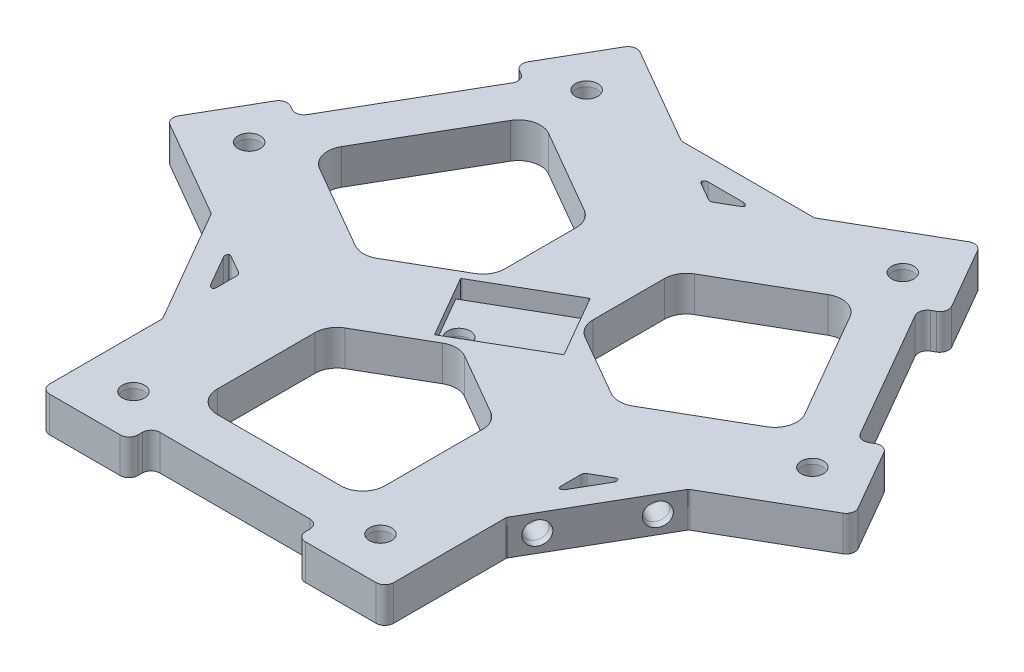
from build123d import *
from OCP.BRepFilletAPI import BRepFilletAPI_MakeChamfer

# Parameters (mm, degrees)
BOSS_EXTRUDE1_DEPTH         = 8
SKETCH3_R                   = 2.3750000000000027
SKETCH3_R_2                 = 2.3749999999999987
CUT_EXTRUDE1_DEPTH          = 7
FILLET1_R                   = 1
CIRPATTERN4_COUNT           = 3
FILLET1_OF_CIRPATTERN4_R    = 1
CHAMFER1_SIZE               = 0.15
CHAMFER1_SIZE2              = 1.0673054583576573
CUT_EXTRUDE2_REACH          = 105.494
SKETCH6_W                   = 37.999999999999986
SKETCH6_H                   = 5
FILLET2_R                   = 2
FILLET3_R                   = 5
BOSS_EXTRUDE2_DEPTH         = 8
SKETCH8_R                   = 2.3750000000000004
CUT_EXTRUDE3_DEPTH          = 7
FILLET4_R                   = 1
CIRPATTERN5_COUNT           = 3
FILLET4_OF_CIRPATTERN5_R    = 1
CHAMFER2_SIZE               = 0.2
CHAMFER2_SIZE2              = 1.4230739444768743
CHAMFER2_SIZE2_2            = 1.423073944476883
CHAMFER2_SIZE2_3            = 1.423073944476881
FILLET5_R                   = 1
FILLET6_R                   = 1
CUT_EXTRUDE4_DEPTH          = 2
SKETCH10_R                  = 2.3749999999999982
CUT_EXTRUDE5_DEPTH          = 6.5
CHAMFER3_SIZE               = 0.2
CHAMFER3_SIZE2              = 1.4230739444768743
FILLET8_R                   = 0.2
SKETCH17_W                  = 15.99999999999999
SKETCH17_H                  = 8
SKETCH17_W_2                = 15.999999999999972
BOSS_EXTRUDE3_DEPTH         = 20
CIRPATTERN7_COUNT           = 3
CUT_EXTRUDE12_REACH         = 104.943
SKETCH18_R                  = 2.375000000000023
SKETCH18_R_2                = 2.3750000000000027
SKETCH18_R_3                = 2.375000000005001
SKETCH18_R_4                = 2.375000000005148
SKETCH18_R_5                = 2.374999999999309
SKETCH18_R_6                = 2.374999999999633
CHAMFER4_SIZE               = 0.15
CHAMFER4_SIZE2              = 1.0673054583576556
LPATTERN1_COUNT             = 2
LPATTERN1_PITCH             = 33
CHAMFER3_OF_LPATTERN1_SIZE2 = 1.4230739444768743
CHAMFER3_OF_LPATTERN1_SIZE  = 0.2
FILLET8_OF_LPATTERN1_R      = 0.2
BOSS_EXTRUDE4_DEPTH         = 8


with BuildPart() as part:
    # Sketch1 → Boss-Extrude1 (new body)
    with BuildSketch(Plane(origin=(0, 0, 0), x_dir=(1, 0, 0), z_dir=(0, 1, 0))):
        Polygon((-39, 67.54998149518622), (-78.00000000000001, 1.423e-14), (-38.999999999999964, -67.54998149518627), (39.000000000000036, -67.54998149518624), (78.00000000000004, 7.21e-15), (39.00000000000003, 67.54998149518623), align=None)
    extrude(amount=BOSS_EXTRUDE1_DEPTH)

    # Sketch3 → Cut-Extrude1 (cut)
    with BuildSketch(Plane.XY.offset(67.54998149518626)):
        with Locations((34, 3.9999999999999982)):
            Circle(SKETCH3_R)
        with Locations((-34, 4)):
            Circle(SKETCH3_R)
        with Locations((-24, 4.000000000000001)):
            Circle(SKETCH3_R_2)
        with Locations((24, 3.9999999999999982)):
            Circle(SKETCH3_R_2)
    cut_extrude1 = extrude(amount=-CUT_EXTRUDE1_DEPTH, mode=Mode.SUBTRACT)

    # Fillet1
    fillet1_edges = [part.edges().sort_by_distance(p)[0] for p in [
        (31.62500000000002, 3.9999999999999987, 60.54998149518626),
        (-36.37499999999998, 4, 60.54998149518626),
        (-26.374999999999975, 4.000000000000001, 60.54998149518626),
        (21.625000000000025, 3.9999999999999987, 60.54998149518626),
    ]]
    fillet(fillet1_edges, radius=FILLET1_R)

    # CirPattern4: Cut-Extrude1 ×3 about axis
    cirpattern4_axis = Axis((1.202e-14, 0, -5.78e-15), (0, 1, 0))
    for i in range(1, CIRPATTERN4_COUNT):
        add(cut_extrude1.rotate(cirpattern4_axis, i * 360 / CIRPATTERN4_COUNT), mode=Mode.SUBTRACT)

    # Fillet1 of CirPattern4
    fillet1_of_cirpattern4_edges = [part.edges().sort_by_distance(p)[0] for p in [
        (36.625322173508984, 3.9999999999999987, -57.66304414227601),
        (70.62532217350898, 4, 1.2266833150658254),
        (65.62532217350898, 4.000000000000001, -7.433570722778564),
        (41.625322173508984, 3.9999999999999987, -49.002790104431625),
        (-68.25032217350896, 3.9999999999999987, -2.8869373529102957),
        (-34.25032217350893, 4, -61.77666481025211),
        (-39.250322173508934, 4.000000000000001, -53.11641077240772),
        (-63.250322173508955, 3.9999999999999987, -11.547191390754675),
    ]]
    fillet(fillet1_of_cirpattern4_edges, radius=FILLET1_OF_CIRPATTERN4_R)

    # Chamfer1: one chamfer whose edges measure the first distance from different faces: ONE call of the kernel's chamfer builder (chamfer() names one face for all edges)
    chamfer1_edges_1 = [part.edges().sort_by_distance(p)[0] for p in [
        (31.62500000000002, 3.9999999999999987, 67.54998149518626),
        (-36.37499999999998, 4, 67.54998149518626),
        (-26.374999999999975, 4.000000000000001, 67.54998149518626),
        (21.625000000000025, 3.9999999999999987, 67.54998149518626),
    ]]
    chamfer1_side_1 = [part.faces().sort_by_distance(p)[0] for p in [
        (4.174e-14, 4.000000000000001, 67.54998149518626),
    ]]
    chamfer1_edges_2 = [part.edges().sort_by_distance(p)[0] for p in [
        (76.68750000000004, 4, -2.27331668493418),
        (71.68750000000004, 4.000000000000001, -10.933570722778565),
        (47.68750000000006, 3.9999999999999987, -52.502790104431625),
        (42.68750000000006, 3.9999999999999987, -61.16304414227601),
    ]]
    chamfer1_side_2 = [part.faces().sort_by_distance(p)[0] for p in [
        (58.50000000000003, 4.000000000000001, -33.77499074759312),
    ]]
    chamfer1_edges_3 = [part.edges().sort_by_distance(p)[0] for p in [
        (-74.31250000000003, 3.9999999999999987, -6.386937352910298),
        (-40.3125, 4, -65.2766648102521),
        (-45.31250000000001, 4.000000000000001, -56.61641077240772),
        (-69.31250000000003, 3.9999999999999987, -15.047191390754676),
    ]]
    chamfer1_side_3 = [part.faces().sort_by_distance(p)[0] for p in [
        (-58.50000000000001, 4.000000000000001, -33.774990747593115),
    ]]
    chamfer1 = BRepFilletAPI_MakeChamfer(part.part.solid().wrapped)
    for e in chamfer1_edges_1:
        chamfer1.Add(CHAMFER1_SIZE, CHAMFER1_SIZE2, e.wrapped, chamfer1_side_1[0].wrapped)  # the first distance lies on this face
    for e in chamfer1_edges_2:
        chamfer1.Add(CHAMFER1_SIZE, CHAMFER1_SIZE2, e.wrapped, chamfer1_side_2[0].wrapped)  # the first distance lies on this face
    for e in chamfer1_edges_3:
        chamfer1.Add(CHAMFER1_SIZE, CHAMFER1_SIZE2, e.wrapped, chamfer1_side_3[0].wrapped)  # the first distance lies on this face
    add(Compound.cast(chamfer1.Shape()), mode=Mode.REPLACE)

    # Sketch6 → Cut-Extrude2 (cut, up to next)
    with BuildSketch(Plane(origin=(0, 8, 0), x_dir=(1, 0, 0), z_dir=(0, 1, 0)), mode=Mode.PRIVATE) as cut_extrude2_sk1:
        Polygon((39.00000000000069, 67.54998149518588), (-9.7e-16, 45.03332099679091), (-38.999999999999766, 67.5499814951864), align=None)
    cut_extrude2_tool1 = extrude(cut_extrude2_sk1.sketch, amount=-CUT_EXTRUDE2_REACH, mode=Mode.PRIVATE) & part.part
    # Sketch6 → Cut-Extrude2 (cut, up to next)
    with BuildSketch(Plane(origin=(0, 8, 0), x_dir=(1, 0, 0), z_dir=(0, 1, 0)), mode=Mode.PRIVATE) as cut_extrude2_sk2:
        Polygon((-36.009618943233434, 42.72947341949735), (-9.999999999999911, 27.7128129211021), (-9.999999999999973, 5.773502691896304), (-29.000000000000057, -5.196152422706482), (-55.00961894323343, 9.82050807568869), (-45.50961894323342, 26.274990747593012), align=None)
    cut_extrude2_tool2 = extrude(cut_extrude2_sk2.sketch, amount=-CUT_EXTRUDE2_REACH, mode=Mode.PRIVATE) & part.part
    # Sketch6 → Cut-Extrude2 (cut, up to next)
    with BuildSketch(Plane(origin=(0, 8, 0), x_dir=(1, 0, 0), z_dir=(0, 1, 0)), mode=Mode.PRIVATE) as cut_extrude2_sk3:
        Polygon((-78.00000000000006, 4.0939e-13), (-38.999999999999964, -22.51666049839541), (-38.999999999999964, -67.54998149518627), align=None)
    cut_extrude2_tool3 = extrude(cut_extrude2_sk3.sketch, amount=-CUT_EXTRUDE2_REACH, mode=Mode.PRIVATE) & part.part
    # Sketch6 → Cut-Extrude2 (cut, up to next)
    with BuildSketch(Plane(origin=(0, 8, 0), x_dir=(1, 0, 0), z_dir=(0, 1, 0)), mode=Mode.PRIVATE) as cut_extrude2_sk4:
        Polygon((-18.999999999999993, -52.549981495186294), (-2.3e-16, -52.54998149518628), (18.999999999999993, -52.549981495186294), (19, -22.51666049839544), (0, -11.547005383792502), (-18.999999999999993, -22.516660498395435), align=None)
    cut_extrude2_tool4 = extrude(cut_extrude2_sk4.sketch, amount=-CUT_EXTRUDE2_REACH, mode=Mode.PRIVATE) & part.part
    # Sketch6 → Cut-Extrude2 (cut, up to next)
    with BuildSketch(Plane(origin=(0, 8, 0), x_dir=(1, 0, 0), z_dir=(0, 1, 0)), mode=Mode.PRIVATE) as cut_extrude2_sk5:
        Polygon((55.00961894323342, 9.820508075688727), (28.999999999999982, -5.196152422706877), (10.000000000000048, 5.773502691896163), (10.00000000000028, 27.712812921101953), (36.009618943233406, 42.72947341949738), (45.50961894323341, 26.274990747593044), align=None)
    cut_extrude2_tool5 = extrude(cut_extrude2_sk5.sketch, amount=-CUT_EXTRUDE2_REACH, mode=Mode.PRIVATE) & part.part
    # Sketch6 → Cut-Extrude2 (cut, up to next)
    with BuildSketch(Plane(origin=(0, 8, 0), x_dir=(1, 0, 0), z_dir=(0, 1, 0)), mode=Mode.PRIVATE) as cut_extrude2_sk6:
        Polygon((78.00000000000004, -6.6093e-13), (38.99999999999998, -22.516660498395257), (38.99999999999998, -67.54998149518627), align=None)
    cut_extrude2_tool6 = extrude(cut_extrude2_sk6.sketch, amount=-CUT_EXTRUDE2_REACH, mode=Mode.PRIVATE) & part.part
    # Sketch6 → Cut-Extrude2 (cut, up to next)
    with BuildSketch(Plane(origin=(0, 8, 0), x_dir=(1, 0, 0), z_dir=(0, 1, 0)), mode=Mode.PRIVATE) as cut_extrude2_sk7:
        Polygon((-49.00000000000007, 50.22947341949745), (-44.66987298107787, 47.72947341949745), (-63.66987298107786, 14.820508075688792), (-68.00000000000006, 17.320508075688792), align=None)
    cut_extrude2_tool7 = extrude(cut_extrude2_sk7.sketch, amount=-CUT_EXTRUDE2_REACH, mode=Mode.PRIVATE) & part.part
    # Sketch6 → Cut-Extrude2 (cut, up to next)
    with BuildSketch(Plane(origin=(0, 8, 0), x_dir=(1, 0, 0), z_dir=(0, 1, 0)), mode=Mode.PRIVATE) as cut_extrude2_sk8:
        Polygon((68.00000000000004, 17.320508075688842), (63.669872981077845, 14.82050807568884), (44.669872981077845, 47.72947341949749), (49.00000000000004, 50.22947341949749), align=None)
    cut_extrude2_tool8 = extrude(cut_extrude2_sk8.sketch, amount=-CUT_EXTRUDE2_REACH, mode=Mode.PRIVATE) & part.part
    # Sketch6 → Cut-Extrude2 (cut, up to next)
    with BuildSketch(Plane(origin=(0, 8, 0), x_dir=(1, 0, 0), z_dir=(0, 1, 0)), mode=Mode.PRIVATE) as cut_extrude2_sk9:
        with Locations((0, -65.04998149518627)):
            Rectangle(SKETCH6_W, SKETCH6_H)
    cut_extrude2_tool9 = extrude(cut_extrude2_sk9.sketch, amount=-CUT_EXTRUDE2_REACH, mode=Mode.PRIVATE) & part.part
    add(cut_extrude2_tool1.solids().sort_by_distance((0, 8, -60.044428))[0], mode=Mode.SUBTRACT)
    add(cut_extrude2_tool2.solids().sort_by_distance((-30.007558, 8, -17.324872))[0], mode=Mode.SUBTRACT)
    add(cut_extrude2_tool3.solids().sort_by_distance((-52, 8, 30.022214))[0], mode=Mode.SUBTRACT)
    add(cut_extrude2_tool4.solids().sort_by_distance((0, 8, 34.649743))[0], mode=Mode.SUBTRACT)
    add(cut_extrude2_tool5.solids().sort_by_distance((30.007558, 8, -17.324872))[0], mode=Mode.SUBTRACT)
    add(cut_extrude2_tool6.solids().sort_by_distance((52, 8, 30.022214))[0], mode=Mode.SUBTRACT)
    add(cut_extrude2_tool7.solids().sort_by_distance((-56.334936, 8, -32.524991))[0], mode=Mode.SUBTRACT)
    add(cut_extrude2_tool8.solids().sort_by_distance((56.334936, 8, -32.524991))[0], mode=Mode.SUBTRACT)
    add(cut_extrude2_tool9.solids().sort_by_distance((0, 8, 65.049981))[0], mode=Mode.SUBTRACT)

    # Fillet2
    fillet2_edges = [part.edges().sort_by_distance(p)[0] for p in [
        (39.00000000000003, 4, -67.54998149518623),
        (78.00000000000004, 4, -7.21e-15),
        (39.000000000000036, 4, 67.54998149518624),
        (-38.999999999999964, 4, 67.54998149518627),
        (-78.00000000000001, 4, -1.423e-14),
        (-39, 4, -67.54998149518622),
        (-18.999999999999993, 4, 62.54998149518627),
        (18.999999999999993, 4, 62.54998149518627),
        (18.999999999999993, 4, 67.54998149518627),
        (-18.999999999999993, 4, 67.54998149518627),
        (49.00000000000004, 4, -50.22947341949749),
        (68.00000000000004, 4, -17.320508075688842),
        (63.669872981077845, 4, -14.82050807568884),
        (44.669872981077845, 4, -47.72947341949749),
        (-68.00000000000006, 4, -17.320508075688792),
        (-49.00000000000007, 4, -50.22947341949745),
        (-44.66987298107787, 4, -47.72947341949745),
        (-63.66987298107786, 4, -14.820508075688792),
    ]]
    fillet(fillet2_edges, radius=FILLET2_R)

    # Fillet3
    fillet3_edges = [part.edges().sort_by_distance(p)[0] for p in [
        (55.00961894323342, 4, -9.820508075688727),
        (28.999999999999982, 4, 5.196152422706877),
        (10.000000000000048, 4, -5.773502691896163),
        (10.00000000000028, 4, -27.712812921101953),
        (36.009618943233406, 4, -42.72947341949738),
        (18.999999999999993, 4, 52.549981495186294),
        (-18.999999999999993, 4, 52.549981495186294),
        (-18.999999999999993, 4, 22.516660498395435),
        (0, 4, 11.547005383792502),
        (19, 4, 22.51666049839544),
        (-36.009618943233434, 4, -42.72947341949735),
        (-9.999999999999911, 4, -27.7128129211021),
        (-9.999999999999973, 4, -5.773502691896304),
        (-29.000000000000057, 4, 5.196152422706482),
        (-55.00961894323343, 4, -9.82050807568869),
    ]]
    fillet(fillet3_edges, radius=FILLET3_R)

    # Sketch7 → Boss-Extrude2 (add)
    with BuildSketch(Plane(origin=(0, 8, 0), x_dir=(1, 0, 0), z_dir=(0, 1, 0))):
        Polygon((-15, 53.69357503463551), (-15, 53.74998149518645), (-5.000000000000001, 53.74998149518645), (5.000000000000001, 53.74998149518645), (15, 53.74998149518645), (15, 53.69357503463551), (4.999999999999996, 47.920072342739246), (5.000000000000002, 48.74998149518646), (-5.000000000000002, 48.74998149518646), (-4.999999999999996, 47.920072342739246), align=None)
        Polygon((39.04884942777496, -39.86537180435979), (44.048849427774954, -31.205117766515407), (49.04884942777496, -22.54486372867102), (54.048849427774954, -13.884609690826633), (54.00000000000022, -13.856406460551433), (44.00000000000018, -19.629909152447645), (44.71872240885278, -20.04486372867103), (39.71872240885278, -28.705117766515414), (39.00000000000014, -28.290163190292006), (39.0000000000001, -39.83716857408452), align=None)
        Polygon((-54.048849427774954, -13.884609690826673), (-49.04884942777495, -22.544863728671057), (-44.04884942777494, -31.205117766515443), (-39.04884942777494, -39.86537180435983), (-38.99999999999921, -39.83716857408482), (-38.99999999999921, -28.290163190292304), (-39.718722408852756, -28.705117766515443), (-44.71872240885276, -20.044863728671057), (-43.99999999999921, -19.629909152447922), (-53.999999999999226, -13.856406460551671), align=None)
    extrude(amount=-BOSS_EXTRUDE2_DEPTH)

    # Sketch8 → Cut-Extrude3 (cut)
    with BuildSketch(Plane(origin=(0, 0, -53.74998149518645), x_dir=(-1, 0, 0), z_dir=(0, 0, -1))):
        with Locations((-10.000000000000147, 4)):
            Circle(SKETCH8_R)
        with Locations((9.999999999999998, 3.999999999999999)):
            Circle(SKETCH8_R)
    cut_extrude3 = extrude(amount=-CUT_EXTRUDE3_DEPTH, mode=Mode.SUBTRACT)

    # Fillet4
    fillet4_edges = [part.edges().sort_by_distance(p)[0] for p in [
        (12.375000000000147, 4, -46.74998149518645),
        (-7.624999999999998, 3.9999999999999996, -46.74998149518645),
    ]]
    fillet(fillet4_edges, radius=FILLET4_R)

    # CirPattern5: Cut-Extrude3 ×3 about axis
    cirpattern5_axis = Axis((-1.402e-14, 0, 5.78e-15), (0, 1, 0))
    for i in range(1, CIRPATTERN5_COUNT):
        add(cut_extrude3.rotate(cirpattern5_axis, i * 360 / CIRPATTERN5_COUNT), mode=Mode.SUBTRACT)

    # Fillet4 of CirPattern5
    fillet4_of_cirpattern5_edges = [part.edges().sort_by_distance(p)[0] for p in [
        (-46.67417160128398, 4, 12.657926375760653),
        (-36.67417160128391, 3.9999999999999996, 29.97843445144955),
        (34.299171601283774, 4, 34.092055119425815),
        (44.29917160128385, 3.9999999999999996, 16.771547043736923),
    ]]
    fillet(fillet4_of_cirpattern5_edges, radius=FILLET4_OF_CIRPATTERN5_R)

    # Chamfer2: one chamfer whose edges measure the first distance from different faces: ONE call of the kernel's chamfer builder (chamfer() names one face for all edges)
    chamfer2_edges_1 = [part.edges().sort_by_distance(p)[0] for p in [
        (12.375000000000147, 4, -53.74998149518645),
        (-7.624999999999998, 3.9999999999999996, -53.74998149518645),
    ]]
    chamfer2_side_1 = [part.faces().sort_by_distance(p)[0] for p in [
        (-1.432e-14, 3.9999999999999996, -53.74998149518645),
    ]]
    chamfer2_edges_2 = [part.edges().sort_by_distance(p)[0] for p in [
        (-52.73634942777505, 4, 16.157926375760653),
        (-42.73634942777498, 3.9999999999999996, 33.47843445144955),
    ]]
    chamfer2_side_2 = [part.faces().sort_by_distance(p)[0] for p in [
        (-46.548849427774925, 3.9999999999999996, 26.874990747593273),
    ]]
    chamfer2_edges_3 = [part.edges().sort_by_distance(p)[0] for p in [
        (40.36134942777484, 4, 37.59205511942582),
        (50.36134942777492, 3.9999999999999996, 20.27154704373693),
    ]]
    chamfer2_side_3 = [part.faces().sort_by_distance(p)[0] for p in [
        (46.54884942777497, 4, 26.874990747593188),
    ]]
    chamfer2 = BRepFilletAPI_MakeChamfer(part.part.solid().wrapped)
    for e in chamfer2_edges_1:
        chamfer2.Add(CHAMFER2_SIZE, CHAMFER2_SIZE2, e.wrapped, chamfer2_side_1[0].wrapped)  # the first distance lies on this face
    for e in chamfer2_edges_2:
        chamfer2.Add(CHAMFER2_SIZE, CHAMFER2_SIZE2_2, e.wrapped, chamfer2_side_2[0].wrapped)  # the first distance lies on this face
    for e in chamfer2_edges_3:
        chamfer2.Add(CHAMFER2_SIZE, CHAMFER2_SIZE2_3, e.wrapped, chamfer2_side_3[0].wrapped)  # the first distance lies on this face
    add(Compound.cast(chamfer2.Shape()), mode=Mode.REPLACE)

    # Fillet5
    # the kernel refuses this fillet: 1 mm, written as the material it adds along each edge
    with BuildSketch(Plane(origin=(-39.718722408852756, 8, 28.705117766515443), x_dir=(0.8660254037849977, 0, -0.49999999999903166), z_dir=(0, -1, 0))) as fillet5_piece_1:
        with BuildLine():
            CenterArc((FILLET5_R, -FILLET5_R), FILLET5_R, 89.99999999999993, 89.9999999999357)
            Line((-1.11755e-12, -FILLET5_R), (0, 0))
            Line((0, 0), (FILLET5_R, 0))
        make_face()
    extrude(amount=8)
    with BuildSketch(Plane(origin=(-44.71872240885276, 8, 20.044863728671057), x_dir=(0.5, 0, 0.8660254037844387), z_dir=(0, -1, 0))) as fillet5_piece_2:
        with BuildLine():
            CenterArc((FILLET5_R, -FILLET5_R), FILLET5_R, 90.00000000000007, 90.00000000006429)
            Line((1.12545e-12, -FILLET5_R), (0, 0))
            Line((0, 0), (FILLET5_R, 0))
        make_face()
    extrude(amount=8)
    with BuildSketch(Plane(origin=(-43.99999999999921, 8, 19.629909152447922), x_dir=(0.8660254037846238, 0, 0.49999999999967903), z_dir=(0, -1, 0))) as fillet5_piece_3:
        with BuildLine():
            CenterArc((FILLET5_R * 0.577350269188, FILLET5_R), FILLET5_R, 210.00000000007526, 59.99999999994645)
            Line((-FILLET5_R * 0.288675134595, FILLET5_R * 0.499999999999), (0, 0))
            Line((0, 0), (FILLET5_R * 0.577350269189, 0))
        make_face()
    extrude(amount=8)
    with BuildSketch(Plane(origin=(-38.999999999999964, 8, 22.51666049839541), x_dir=(-0.8660254037844345, 0, -0.5000000000000072), z_dir=(0, -1, 0))) as fillet5_piece_4:
        with BuildLine():
            CenterArc((FILLET5_R * 0.57735026919, -FILLET5_R), FILLET5_R, 90.00000000000001, 59.99999999999993)
            Line((-FILLET5_R * 0.288675134595, -FILLET5_R * 0.5), (0, 0))
            Line((0, 0), (FILLET5_R * 0.57735026919, -2e-17))
        make_face()
    extrude(amount=8)
    with BuildSketch(Plane(origin=(-38.99999999999921, 8, 28.290163190292304), x_dir=(-1.304537886440923e-12, 0, -1.0), z_dir=(0, -1, 0))) as fillet5_piece_5:
        with BuildLine():
            CenterArc((FILLET5_R * 0.577350269192, -FILLET5_R), FILLET5_R, 90.00000000007475, 60.00000000002677)
            Line((-FILLET5_R * 0.288675134594, -FILLET5_R * 0.500000000002), (0, 0))
            Line((0, 0), (FILLET5_R * 0.57735026919, 0))
        make_face()
    extrude(amount=8)
    with BuildSketch(Plane(origin=(39.71872240885278, 8, 28.705117766515414), x_dir=(0.5000000000000017, 0, -0.8660254037844377), z_dir=(0, -1, 0))) as fillet5_piece_6:
        with BuildLine():
            CenterArc((FILLET5_R, -FILLET5_R), FILLET5_R, 89.99999999999982, 89.99999999998359)
            Line((-2.9134e-13, -FILLET5_R), (0, 0))
            Line((0, 0), (FILLET5_R, -5e-17))
        make_face()
    extrude(amount=8)
    with BuildSketch(Plane(origin=(44.71872240885278, 8, 20.04486372867103), x_dir=(-0.8660254037845849, 0, -0.49999999999974676), z_dir=(0, -1, 0))) as fillet5_piece_7:
        with BuildLine():
            CenterArc((FILLET5_R, -FILLET5_R), FILLET5_R, 89.99999999999982, 90.00000000001722)
            Line((2.9259e-13, -FILLET5_R), (0, 0))
            Line((0, 0), (FILLET5_R, 1e-17))
        make_face()
    extrude(amount=8)
    with BuildSketch(Plane(origin=(44.00000000000018, 8, 19.629909152447645), x_dir=(-0.8660254037848379, 0, 0.4999999999993085), z_dir=(0, -1, 0))) as fillet5_piece_8:
        with BuildLine():
            CenterArc((FILLET5_R * 0.577350269189, -FILLET5_R), FILLET5_R, 89.99999999995524, 60.00000000000472)
            Line((-FILLET5_R * 0.288675134595, -FILLET5_R * 0.499999999999), (0, 0))
            Line((0, 0), (FILLET5_R * 0.577350269189, -2e-17))
        make_face()
    extrude(amount=8)
    with BuildSketch(Plane(origin=(38.99999999999998, 8, 22.516660498395257), x_dir=(0.866025403784446, 0, -0.4999999999999873), z_dir=(0, -1, 0))) as fillet5_piece_9:
        with BuildLine():
            CenterArc((FILLET5_R * 0.57735026919, FILLET5_R), FILLET5_R, 209.99999999999915, 60.000000000000966)
            Line((-FILLET5_R * 0.288675134595, FILLET5_R * 0.5), (0, 0))
            Line((0, 0), (FILLET5_R * 0.57735026919, -5e-17))
        make_face()
    extrude(amount=8)
    with BuildSketch(Plane(origin=(39.00000000000014, 8, 28.290163190292006), x_dir=(0.8660254037845821, 0, 0.4999999999997515), z_dir=(0, -1, 0))) as fillet5_piece_10:
        with BuildLine():
            CenterArc((FILLET5_R * 0.57735026919, -FILLET5_R), FILLET5_R, 89.99999999999996, 60.0000000000165)
            Line((-FILLET5_R * 0.288675134595, -FILLET5_R * 0.5), (0, 0))
            Line((0, 0), (FILLET5_R * 0.57735026919, 1e-17))
        make_face()
    extrude(amount=8)
    with BuildSketch(Plane(origin=(-5.000000000000002, 8, -48.74998149518646), x_dir=(7.11e-15, 0, 1), z_dir=(0, -1, 0))) as fillet5_piece_11:
        with BuildLine():
            CenterArc((FILLET5_R, -FILLET5_R), FILLET5_R, 90, 90.0000000000004)
            Line((7.11e-15, -FILLET5_R), (0, 0))
            Line((0, 0), (FILLET5_R, 0))
        make_face()
    extrude(amount=8)
    with BuildSketch(Plane(origin=(5.000000000000002, 8, -48.74998149518646), x_dir=(-1, 0, 0), z_dir=(0, -1, 0))) as fillet5_piece_12:
        with BuildLine():
            CenterArc((FILLET5_R, -FILLET5_R), FILLET5_R, 90, 90.0000000000004)
            Line((7.11e-15, -FILLET5_R), (0, 0))
            Line((0, 0), (FILLET5_R, 0))
        make_face()
    extrude(amount=8)
    with BuildSketch(Plane(origin=(-4.999999999999996, 8, -47.920072342739246), x_dir=(0.8660254037843009, 0, 0.5000000000002386), z_dir=(0, -1, 0))) as fillet5_piece_13:
        with BuildLine():
            CenterArc((FILLET5_R * 0.577350269189, -FILLET5_R), FILLET5_R, 89.99999999998458, 60.00000000000698)
            Line((-FILLET5_R * 0.288675134595, -FILLET5_R * 0.5), (0, 0))
            Line((0, 0), (FILLET5_R * 0.57735026919, 3e-17))
        make_face()
    extrude(amount=8)
    with BuildSketch(Plane(origin=(-9.7e-16, 8, -45.03332099679091), x_dir=(-0.8660254037844386, 0, -0.5000000000000001), z_dir=(0, -1, 0))) as fillet5_piece_14:
        with BuildLine():
            CenterArc((FILLET5_R * 0.57735026919, FILLET5_R), FILLET5_R, 210.00000000000082, 59.999999999999545)
            Line((-FILLET5_R * 0.288675134595, FILLET5_R * 0.5), (0, 0))
            Line((0, 0), (FILLET5_R * 0.57735026919, -2e-17))
        make_face()
    extrude(amount=8)
    with BuildSketch(Plane(origin=(4.999999999999996, 8, -47.920072342739246), x_dir=(7.69e-15, 0, -1), z_dir=(0, -1, 0))) as fillet5_piece_15:
        with BuildLine():
            CenterArc((FILLET5_R * 0.57735026919, -FILLET5_R), FILLET5_R, 89.99999999999997, 60.00000000000148)
            Line((-FILLET5_R * 0.288675134595, -FILLET5_R * 0.5), (0, 0))
            Line((0, 0), (FILLET5_R * 0.57735026919, 0))
        make_face()
    extrude(amount=8)

    # Fillet6
    # the kernel refuses this fillet: 1 mm, written as the material it adds along each edge
    with BuildSketch(Plane(origin=(-15, 8, -53.69357503463551), x_dir=(-0.8660254037845956, 0, -0.4999999999997282), z_dir=(0, -1, 0))) as fillet6_piece_1:
        with BuildLine():
            CenterArc((0.3369306002241972, 0.9999999999999986), FILLET6_R, 252.0174473717792, 17.982552628239205)
            Line((0.02820323027545401, 0.04884942777468653), (0, 0))
            Line((0, 0), (0.336930600224518, 0))
        make_face()
    extrude(amount=8)
    with BuildSketch(Plane(origin=(15, 8, -53.69357503463551), x_dir=(0, 0, -1), z_dir=(0, -1, 0))) as fillet6_piece_2:
        with BuildLine():
            CenterArc((1.0344907038968358, -0.20820954089206367), FILLET6_R, 150.00000000000097, 17.98255262830321)
            Line((0.1684653001123877, 0.2917904591079221), (0, 0))
            Line((0, 0), (0.05640646055093868, 0))
        make_face()
    extrude(amount=8)
    with BuildSketch(Plane(origin=(54.00000000000022, 8, 13.856406460551433), x_dir=(0.8660254037839653, 0, -0.5000000000008199), z_dir=(0, -1, 0))) as fillet6_piece_3:
        with BuildLine():
            CenterArc((0.3369306002237716, 0.9999999999999997), FILLET6_R, 252.01744737181392, 17.98255262824125)
            Line((0.02820323027560471, 0.04884942777450156), (0, 0))
            Line((0, 0), (0.3369306002247345, -2e-17))
        make_face()
    extrude(amount=8)
    with BuildSketch(Plane(origin=(39.0000000000001, 8, 39.83716857408452), x_dir=(0.8660254037868077, 0, 0.4999999999958966), z_dir=(0, -1, 0))) as fillet6_piece_4:
        with BuildLine():
            CenterArc((1.0344907038977758, -0.2082095408879267), FILLET6_R, 150.00000000027148, 17.982552628275073)
            Line((0.16846530011096802, 0.2917904591079699), (0, 0))
            Line((0, 0), (0.05640646055099658, 0))
        make_face()
    extrude(amount=8)
    with BuildSketch(Plane(origin=(-38.99999999999921, 8, 39.83716857408482), x_dir=(-0.8660254037926135, 0, 0.49999999998584094), z_dir=(0, -1, 0))) as fillet6_piece_5:
        with BuildLine():
            CenterArc((1.0344907039008118, 0.20820954087659185), FILLET6_R, 192.01744737078945, 17.982552628273766)
            Line((0.1684653001081983, -0.29179045910924906), (0, 0))
            Line((0, 0), (0.05640646055161941, 0))
        make_face()
    extrude(amount=8)
    with BuildSketch(Plane(origin=(-53.999999999999226, 8, 13.856406460551671), x_dir=(-0.8660254037839715, 0, -0.5000000000008089), z_dir=(0, -1, 0))) as fillet6_piece_6:
        with BuildLine():
            CenterArc((0.33693060022570903, -1.0000000000000009), FILLET6_R, 89.99999999994692, 17.982552628297938)
            Line((0.02820323027656806, -0.04884942777482321), (0, 0))
            Line((0, 0), (0.33693060022663546, -2e-17))
        make_face()
    extrude(amount=8)

    # Sketch9 → Cut-Extrude4 (cut)
    with BuildSketch(Plane(origin=(0, 8, 0), x_dir=(1, 0, 0), z_dir=(0, 1, 0))):
        Polygon((-23.102558883257707, -3.9851942293460145), (-15.002558883257707, -18.01480577065392), (-33.62210506462316, -28.76480577065394), (-41.722105064623165, -14.735194229346035), align=None)
    cut_extrude4 = extrude(amount=-CUT_EXTRUDE4_DEPTH, mode=Mode.SUBTRACT)

    # Sketch10 → Cut-Extrude5 (cut)
    with BuildSketch(Plane(origin=(0, 6, 0), x_dir=(1, 0, 0), z_dir=(0, 1, 0))):
        Polygon((-21.602558883257714, -6.583270440699334), (-23.102558883257707, -3.9851942293460145), (-41.722105064623165, -14.735194229346035), (-40.222105064623165, -17.33327044069935), align=None)
        with Locations(Location((-32.3075225023237, -24.541729559300602, 0), (0, 0, 270))):
            Circle(SKETCH10_R)
    cut_extrude5 = extrude(amount=-CUT_EXTRUDE5_DEPTH, mode=Mode.SUBTRACT)

    # Chamfer3
    chamfer3_edges = [part.edges().sort_by_distance(p)[0] for p in [
        (-32.3075225023237, 6, 22.166729559300606),
    ]]
    chamfer3_side = [part.faces().sort_by_distance(p)[0] for p in [
        (-27.299638382627894, 6, 17.216658774278216),
    ]]
    chamfer(chamfer3_edges, length=CHAMFER3_SIZE, length2=CHAMFER3_SIZE2, reference=chamfer3_side[0])

    # Fillet8
    fillet8_edges = [part.edges().sort_by_distance(p)[0] for p in [
        (-41.722105064623165, 4, 14.735194229346035),
        (-23.102558883257707, 4, 3.9851942293460145),
        (-15.002558883257707, 7, 18.01480577065392),
        (-33.62210506462316, 7, 28.76480577065394),
        (-21.602558883257714, 3, 6.583270440699334),
        (-40.222105064623165, 3, 17.33327044069935),
    ]]
    fillet(fillet8_edges, radius=FILLET8_R)

    # Cut-Extrude10 cone 1 section (through the dimple's axis) → Cut-Extrude10 (revolve, cut)
    with BuildSketch(Plane(origin=(0, 8, 0), x_dir=(0, 0, 1), z_dir=(1, 0, 0))):
        Polygon((0, 0), (0.5, 0), (0, 0.5), align=None)
    revolve(axis=Axis((0, 8, 0), (0, -1, 0)), mode=Mode.SUBTRACT)

    # Sketch17 → Boss-Extrude3 (add)
    with BuildSketch(Plane.XY.offset(67.54998149518626)):
        with Locations((28.999999999999964, 4)):
            Rectangle(SKETCH17_W, SKETCH17_H)
        with Locations((-29, 4)):
            Rectangle(SKETCH17_W_2, SKETCH17_H)
    boss_extrude3 = extrude(amount=-BOSS_EXTRUDE3_DEPTH)

    # CirPattern7: Boss-Extrude3 ×3 about axis
    cirpattern7_axis = Axis((0, -0.4000000000000002, 0), (0, 1, 0))
    for i in range(1, CIRPATTERN7_COUNT):
        add(boss_extrude3.rotate(cirpattern7_axis, i * 360 / CIRPATTERN7_COUNT))

    # Sketch18 → Cut-Extrude12 (cut, up to next)
    with BuildSketch(Plane(origin=(0, 8, 0), x_dir=(1, 0, 0), z_dir=(0, 1, 0)), mode=Mode.PRIVATE) as cut_extrude12_sk1:
        with Locations(Location((-63.8397426577242, 4.526285165071788, 0), (0, 0, 270))):
            Circle(SKETCH18_R)
    cut_extrude12_tool1 = extrude(cut_extrude12_sk1.sketch, amount=-CUT_EXTRUDE12_REACH, mode=Mode.PRIVATE) & part.part
    # Sketch18 → Cut-Extrude12 (cut, up to next)
    with BuildSketch(Plane(origin=(0, 8, 0), x_dir=(1, 0, 0), z_dir=(0, 1, 0)), mode=Mode.PRIVATE) as cut_extrude12_sk2:
        with Locations(Location((-35.83974926658709, 53.023696330114284, 0), (0, 0, 270))):
            Circle(SKETCH18_R_2)
    cut_extrude12_tool2 = extrude(cut_extrude12_sk2.sketch, amount=-CUT_EXTRUDE12_REACH, mode=Mode.PRIVATE) & part.part
    # Sketch18 → Cut-Extrude12 (cut, up to next)
    with BuildSketch(Plane(origin=(0, 8, 0), x_dir=(1, 0, 0), z_dir=(0, 1, 0)), mode=Mode.PRIVATE) as cut_extrude12_sk3:
        with Locations(Location((35.83974926658423, 53.023696330119996, 0), (0, 0, 270))):
            Circle(SKETCH18_R_3)
    cut_extrude12_tool3 = extrude(cut_extrude12_sk3.sketch, amount=-CUT_EXTRUDE12_REACH, mode=Mode.PRIVATE) & part.part
    # Sketch18 → Cut-Extrude12 (cut, up to next)
    with BuildSketch(Plane(origin=(0, 8, 0), x_dir=(1, 0, 0), z_dir=(0, 1, 0)), mode=Mode.PRIVATE) as cut_extrude12_sk4:
        with Locations(Location((63.83974265772151, 4.526285165077615, 0), (0, 0, 270))):
            Circle(SKETCH18_R_4)
    cut_extrude12_tool4 = extrude(cut_extrude12_sk4.sketch, amount=-CUT_EXTRUDE12_REACH, mode=Mode.PRIVATE) & part.part
    # Sketch18 → Cut-Extrude12 (cut, up to next)
    with BuildSketch(Plane(origin=(0, 8, 0), x_dir=(1, 0, 0), z_dir=(0, 1, 0)), mode=Mode.PRIVATE) as cut_extrude12_sk5:
        with Locations(Location((27.99999339114083, -57.549981495180994, 0), (0, 0, 270))):
            Circle(SKETCH18_R_5)
    cut_extrude12_tool5 = extrude(cut_extrude12_sk5.sketch, amount=-CUT_EXTRUDE12_REACH, mode=Mode.PRIVATE) & part.part
    # Sketch18 → Cut-Extrude12 (cut, up to next)
    with BuildSketch(Plane(origin=(0, 8, 0), x_dir=(1, 0, 0), z_dir=(0, 1, 0)), mode=Mode.PRIVATE) as cut_extrude12_sk6:
        with Locations(Location((-27.999993391133586, -57.54998149518109, 0), (0, 0, 270))):
            Circle(SKETCH18_R_6)
    cut_extrude12_tool6 = extrude(cut_extrude12_sk6.sketch, amount=-CUT_EXTRUDE12_REACH, mode=Mode.PRIVATE) & part.part
    add(cut_extrude12_tool1.solids().sort_by_distance((-63.839743, 8, -4.526285))[0], mode=Mode.SUBTRACT)
    add(cut_extrude12_tool2.solids().sort_by_distance((-35.839749, 8, -53.023696))[0], mode=Mode.SUBTRACT)
    add(cut_extrude12_tool3.solids().sort_by_distance((35.839749, 8, -53.023696))[0], mode=Mode.SUBTRACT)
    add(cut_extrude12_tool4.solids().sort_by_distance((63.839743, 8, -4.526285))[0], mode=Mode.SUBTRACT)
    add(cut_extrude12_tool5.solids().sort_by_distance((27.999993, 8, 57.549981))[0], mode=Mode.SUBTRACT)
    add(cut_extrude12_tool6.solids().sort_by_distance((-27.999993, 8, 57.549981))[0], mode=Mode.SUBTRACT)

    # Chamfer4
    chamfer4_edges = [part.edges().sort_by_distance(p)[0] for p in [
        (-63.8397426577242, 8, -6.901285165071811),
        (-27.999993391133586, 8, 55.17498149518146),
        (27.99999339114083, 8, 55.17498149518168),
        (63.83974265772151, 8, -6.901285165082763),
        (35.83974926658423, 8, -55.398696330125),
        (-35.83974926658709, 8, -55.398696330114284),
    ]]
    chamfer4_side = [part.faces().sort_by_distance(p)[0] for p in [
        (1.16684744516134, 8, -0.6736796865671888),
    ]]
    chamfer(chamfer4_edges, length=CHAMFER4_SIZE, length2=CHAMFER4_SIZE2, reference=chamfer4_side[0])

    # LPattern1: Cut-Extrude4, Cut-Extrude5 ×2
    with Locations(*[Vector(0.8660254037844378, 2.060641219948207e-14, -0.5000000000000016) * (i * LPATTERN1_PITCH) for i in range(1, LPATTERN1_COUNT)]):
        add(cut_extrude4, mode=Mode.SUBTRACT)
        add(cut_extrude5, mode=Mode.SUBTRACT)

    # Chamfer3 of LPattern1
    chamfer3_of_lpattern1_edges = [part.edges().sort_by_distance(p)[0] for p in [
        (-3.728684177437252, 6.00000000000068, 5.666729559300556),
    ]]
    chamfer(chamfer3_of_lpattern1_edges, length=CHAMFER3_OF_LPATTERN1_SIZE, length2=CHAMFER3_OF_LPATTERN1_SIZE2)

    # Fillet8 of LPattern1
    fillet8_of_lpattern1_edges = [part.edges().sort_by_distance(p)[0] for p in [
        (-13.143266739736717, 4.00000000000068, -1.7648057706540143),
        (5.476279441628741, 4.00000000000068, -12.514805770654036),
        (13.57627944162874, 7.00000000000068, 1.5148057706538687),
        (-5.0432667397367155, 7.00000000000068, 12.26480577065389),
        (6.9762794416287335, 3.00000000000068, -9.916729559300716),
        (-11.643266739736717, 3.00000000000068, 0.8332704406993017),
    ]]
    fillet(fillet8_of_lpattern1_edges, radius=FILLET8_OF_LPATTERN1_R)

    # Sketch19 → Boss-Extrude4 (add)
    with BuildSketch(Plane(origin=(0, 8, 0), x_dir=(1, 0, 0), z_dir=(0, 1, 0))):
        Polygon((-42.77062521199093, -14.406313989785431), (-33.78283933044605, -29.973615784171386), (-14.061356735976748, -18.58741249943601), (-23.049142617521625, -3.0201107050500573), align=None)
    extrude(amount=-BOSS_EXTRUDE4_DEPTH)


solid = part.part
